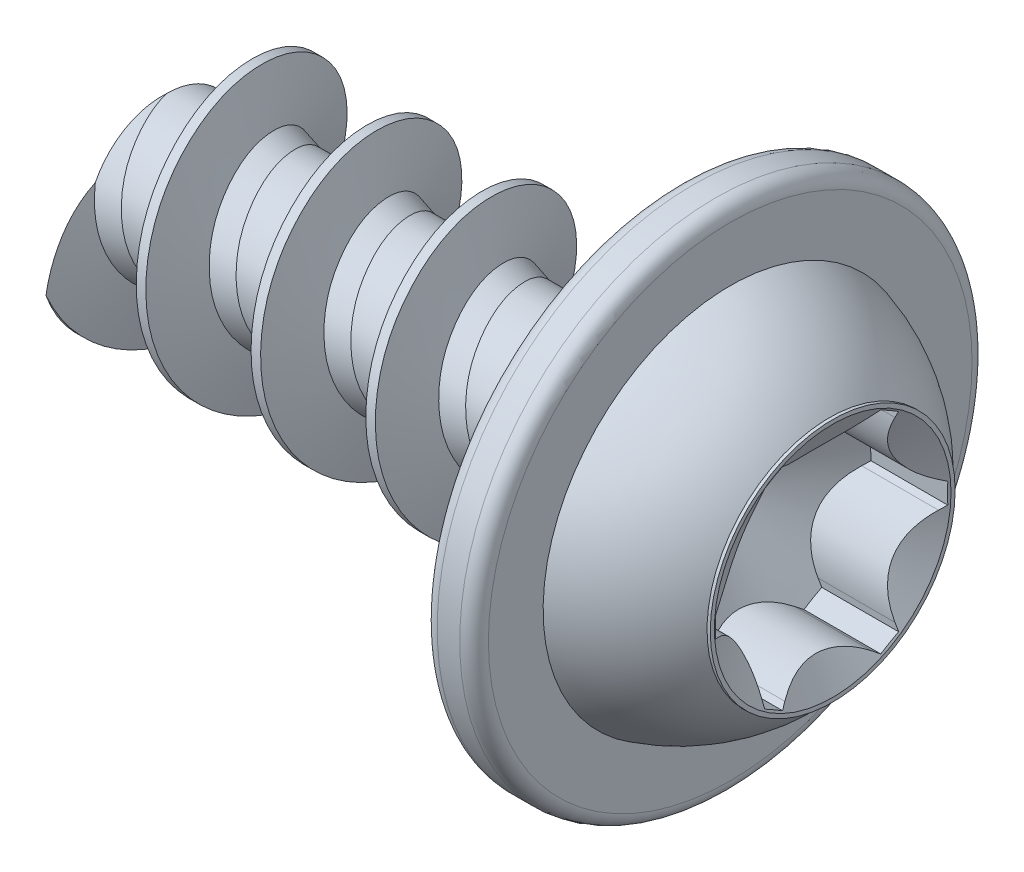
from build123d import *

# Parameters (mm, degrees)
BOSS_EXTRUDE1_REACH = 9.399
SKETCH3_R           = 1.195
SKETCH9_W           = 3.88
SKETCH9_H           = 1.25
CUT_SWEEP1_PITCH    = 1.12


# Read off the part's stored shape, not the designer's step: Split1
with BuildPart() as part:
    # Sketch2 → Revolve1 (revolve)
    with BuildSketch(Plane.XY):
        with BuildLine():
            Line((-3.25, 0), (3.643152133, 0))
            ThreePointArc((3.643152133, 0), (3.255091537, 1.148357291), (2.25, 1.825931269))
            Line((2.25, 1.825931269), (2.25, 2.36))
            ThreePointArc((2.25, 2.36), (2.208994949, 2.458994949), (2.11, 2.5))
            Line((2.11, 2.5), (1.89, 2.5))
            ThreePointArc((1.89, 2.5), (1.791005051, 2.458994949), (1.75, 2.36))
            Line((1.75, 2.36), (1.75, 1.026666667))
            ThreePointArc((1.75, 1.026666667), (1.667989899, 0.828676768), (1.47, 0.746666667))
            Line((1.47, 0.746666667), (0.804162371, 0.746666667))
            Line((0.804162371, 0.746666667), (0.63, 0.7))
            Line((0.63, 0.7), (-3.25, 0.7))
            Line((-3.25, 0.7), (-3.25, 0))
        make_face()
    revolve(axis=Axis((-3.25, 0, 0), (-1, 0, 0)))

    # Sketch13 → Cut-Revolve3 (revolve, cut)
    with BuildSketch(Plane.XY, mode=Mode.PRIVATE) as cut_revolve3_sk:
        Polygon((3.25, 1.155), (2.5, 1.155), (1.833160439, 0), (3.25, 0), (4.666839561, 0), (4.666839561, 1.155), align=None)
    revolve(cut_revolve3_sk.sketch.rotate(Axis((-3.25, 0, 0), (1, 0, 0)), 180), axis=Axis((-3.25, 0, 0), (1, 0, 0)), mode=Mode.SUBTRACT)

    # Boss-Extrude1: up to this cone (the profile starts inside it)
    boss_extrude1_end = Plane(origin=(3.25, 0, 0), z_dir=(1, 0, 0)).offset(-1.416838561) * Cone(1.732e-06, 23.850127733, 13.769876667, align=(Align.CENTER, Align.CENTER, Align.MIN), mode=Mode.PRIVATE)
    # Sketch3 → Boss-Extrude1 (add, up to the surface)
    with BuildSketch(Plane(origin=(3.25, 0, 0), x_dir=(0, 0, -1), z_dir=(1, 0, 0)), mode=Mode.PRIVATE) as boss_extrude1_sk1:
        Circle(SKETCH3_R)
        with BuildLine():
            Line((-1.07444896, -0.129501516), (-1.1332193, -0.100536945))
            Line((-1.1332193, -0.100536945), (-1.1332193, 0.100536945))
            Line((-1.1332193, 0.100536945), (-1.07444896, 0.129501516))
            ThreePointArc((-1.07444896, 0.129501516), (-0.750194506, 0.433125), (-0.649376083, 0.865749337))
            Line((-0.649376083, 0.865749337), (-0.653677199, 0.931128229))
            Line((-0.653677199, 0.931128229), (-0.479542101, 1.031665175))
            Line((-0.479542101, 1.031665175), (-0.425072877, 0.995250853))
            ThreePointArc((-0.425072877, 0.995250853), (0, 0.86625), (0.425072877, 0.995250853))
            Line((0.425072877, 0.995250853), (0.479542101, 1.031665175))
            Line((0.479542101, 1.031665175), (0.653677199, 0.931128229))
            Line((0.653677199, 0.931128229), (0.649376083, 0.865749337))
            ThreePointArc((0.649376083, 0.865749337), (0.750194506, 0.433125), (1.07444896, 0.129501516))
            Line((1.07444896, 0.129501516), (1.1332193, 0.100536945))
            Line((1.1332193, 0.100536945), (1.1332193, -0.100536945))
            Line((1.1332193, -0.100536945), (1.07444896, -0.129501516))
            ThreePointArc((1.07444896, -0.129501516), (0.750194506, -0.433125), (0.649376083, -0.865749337))
            Line((0.649376083, -0.865749337), (0.653677199, -0.931128229))
            Line((0.653677199, -0.931128229), (0.479542101, -1.031665175))
            Line((0.479542101, -1.031665175), (0.425072877, -0.995250853))
            ThreePointArc((0.425072877, -0.995250853), (0, -0.86625), (-0.425072877, -0.995250853))
            Line((-0.425072877, -0.995250853), (-0.479542101, -1.031665175))
            Line((-0.479542101, -1.031665175), (-0.653677199, -0.931128229))
            Line((-0.653677199, -0.931128229), (-0.649376083, -0.865749337))
            ThreePointArc((-0.649376083, -0.865749337), (-0.750194506, -0.433125), (-1.07444896, -0.129501516))
        make_face(mode=Mode.SUBTRACT)
    boss_extrude1_tool1 = extrude(boss_extrude1_sk1.sketch, amount=-BOSS_EXTRUDE1_REACH, mode=Mode.PRIVATE) & boss_extrude1_end
    add(boss_extrude1_tool1.solids().sort_by_distance((3.25, 0, 1.1612))[0])

    # Cut-Extrude2 cone 1 section (through the dimple's axis) → Cut-Extrude2 (revolve, cut)
    with BuildSketch(Plane(origin=(3.25, 0, 0), x_dir=(0, 0, -1), z_dir=(0, 1, 0))):
        Polygon((0, 0), (1.155, 0), (0, 0.666839561), align=None)
    revolve(axis=Axis((3.25, 0, 0), (-1, 0, 0)), mode=Mode.SUBTRACT)

    # Split1 outline → Split1 (revolve, cut)
    with BuildSketch(Plane.YX):
        Polygon((0.7, -3.25), (0.7, 0.63), (0, -1.982435565), (0, -3.25), align=None)
    revolve(axis=Axis((0, 0, 0), (1, 0, 0)), mode=Mode.SUBTRACT)


with BuildPart() as body_2:
    # Split1 2 outline → Split1 2 (revolve)
    with BuildSketch(Plane.YX):
        Polygon((0.7, -3.25), (0.7, 0.63), (0, -1.982435565), (0, -3.25), align=None)
    revolve(axis=Axis((0, 0, 0), (1, 0, 0)))

    # Sketch9 → Revolve2 (revolve)
    with BuildSketch(Plane.XY):
        with Locations((-1.31, 0.625)):
            Rectangle(SKETCH9_W, SKETCH9_H)
    revolve(axis=Axis((-3.25, 0, 0), (1, 0, 0)))

    # Cut-Sweep1: the profile of Sketch7 screwed along a right-hand helix of 5.464286 turns, 8 arcs to a turn; built about Z, then put on its axis
    cut_sweep1_z = Axis((0, 0, 0), (0, 0, 1))
    cut_sweep1_corners = [(1.25, 0, -0.434209315), (0.755859772, 0, -0.56661379), (0.7, 0, -0.775085296), (0.7, 0, -1.12), (0.755859772, 0, -1.328471506), (1.25, 0, -1.460875981), (1.371243557, 0, -1.460875981), (1.371243557, 0, -0.434209315)]
    with BuildLine(mode=Mode.PRIVATE) as cut_sweep1_profile:
        Line(cut_sweep1_corners[0], cut_sweep1_corners[1])
        Line(cut_sweep1_corners[1], cut_sweep1_corners[2])
        Line(cut_sweep1_corners[2], cut_sweep1_corners[3])
        Line(cut_sweep1_corners[3], cut_sweep1_corners[4])
        Line(cut_sweep1_corners[4], cut_sweep1_corners[5])
        Line(cut_sweep1_corners[5], cut_sweep1_corners[6])
        Line(cut_sweep1_corners[6], cut_sweep1_corners[7])
        Line(cut_sweep1_corners[7], cut_sweep1_corners[0])
    cut_sweep1_cap = Face(cut_sweep1_profile.wire())
    cut_sweep1_turn_angles = [0, 22.5, 45, 67.5, 90, 112.5, 135, 157.5, 180, 202.5, 225, 247.5, 270, 292.5, 315, 337.5, 360]
    cut_sweep1_turn_weights = [1, 0.9238795325112867, 1, 0.9238795325112867, 1, 0.9238795325112867, 1, 0.9238795325112867, 1, 0.9238795325112867, 1, 0.9238795325112867, 1, 0.9238795325112867, 1, 0.9238795325112867, 1]
    cut_sweep1_turn_rails = [Edge.make_bspline([Vector(p[0], p[1], 0).rotate(cut_sweep1_z, cut_sweep1_turn_angles[k]) / cut_sweep1_turn_weights[k] + Vector(0, 0, p[2] + CUT_SWEEP1_PITCH * cut_sweep1_turn_angles[k] / 360) for k in range(17)], [0, 0, 0, 1, 1, 2, 2, 3, 3, 4, 4, 5, 5, 6, 6, 7, 7, 8, 8, 8], 2, cut_sweep1_turn_weights) for p in cut_sweep1_corners]
    cut_sweep1_turn_sides = [Face.make_surface_from_curves(cut_sweep1_turn_rails[p[0]], cut_sweep1_turn_rails[p[1]]) for p in [(0, 1), (1, 2), (2, 3), (3, 4), (4, 5), (5, 6), (6, 7), (7, 0)]]
    cut_sweep1_last_angles = [1800, 1822.5, 1845, 1867.5, 1890, 1912.5, 1935, 1951.071428571, 1967.142857143]
    cut_sweep1_last_weights = [1, 0.9238795325112867, 1, 0.9238795325112867, 1, 0.9238795325112867, 1, 0.960917321945099, 1]
    cut_sweep1_last_rails = [Edge.make_bspline([Vector(p[0], p[1], 0).rotate(cut_sweep1_z, cut_sweep1_last_angles[k]) / cut_sweep1_last_weights[k] + Vector(0, 0, p[2] + CUT_SWEEP1_PITCH * cut_sweep1_last_angles[k] / 360) for k in range(9)], [0, 0, 0, 1, 1, 2, 2, 3, 3, 4, 4, 4], 2, cut_sweep1_last_weights) for p in cut_sweep1_corners]
    cut_sweep1_last_sides = [Face.make_surface_from_curves(cut_sweep1_last_rails[p[0]], cut_sweep1_last_rails[p[1]]) for p in [(0, 1), (1, 2), (2, 3), (3, 4), (4, 5), (5, 6), (6, 7), (7, 0)]]
    cut_sweep1 = Plane(origin=(-3.25, 0, 0), x_dir=(0, 1, 0), z_dir=(1, 0, 0)) * Solid(Shell([*[p.moved(Location((0, 0, CUT_SWEEP1_PITCH * i))) for i in range(5) for p in cut_sweep1_turn_sides], *cut_sweep1_last_sides, cut_sweep1_cap, cut_sweep1_cap.rotate(cut_sweep1_z, 1967.142857143).moved(Location((0, 0, CUT_SWEEP1_PITCH * 1967.142857143 / 360)))]))
    add(cut_sweep1, mode=Mode.SUBTRACT)

    # Sketch11 → Cut-Revolve2 (revolve, cut)
    with BuildSketch(Plane.XY, mode=Mode.PRIVATE) as cut_revolve2_sk:
        Polygon((0.63, 0.7), (0.482627944, 1.25), (0.63, 1.25), align=None)
    revolve(cut_revolve2_sk.sketch.rotate(Axis((-3.25, 0, 0), (1, 0, 0)), 270), axis=Axis((-3.25, 0, 0), (1, 0, 0)), mode=Mode.SUBTRACT)

    # Combine1: union part
    add(part.part)


solid = body_2.part
